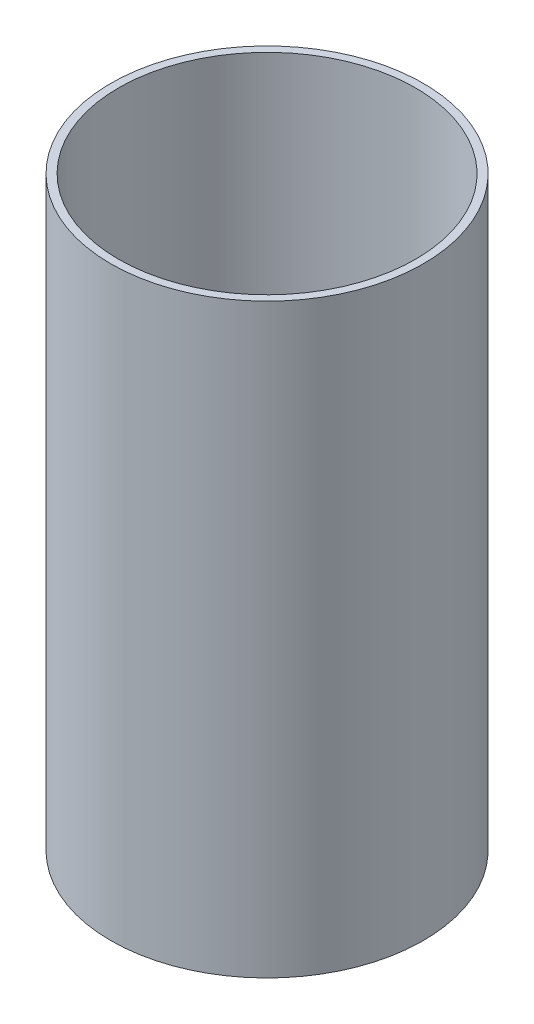
from build123d import *

# Parameters (mm, degrees)
SKETCH1_R           = 40
SKETCH1_R_2         = 38
BOSS_EXTRUDE1_DEPTH = 150


with BuildPart() as part:
    # Sketch1 → Boss-Extrude1 (new body)
    with BuildSketch(Plane(origin=(0, 0, 0), x_dir=(1, 0, 0), z_dir=(0, 1, 0))):
        Circle(SKETCH1_R)
        Circle(SKETCH1_R_2, mode=Mode.SUBTRACT)
    extrude(amount=BOSS_EXTRUDE1_DEPTH)


solid = part.part
